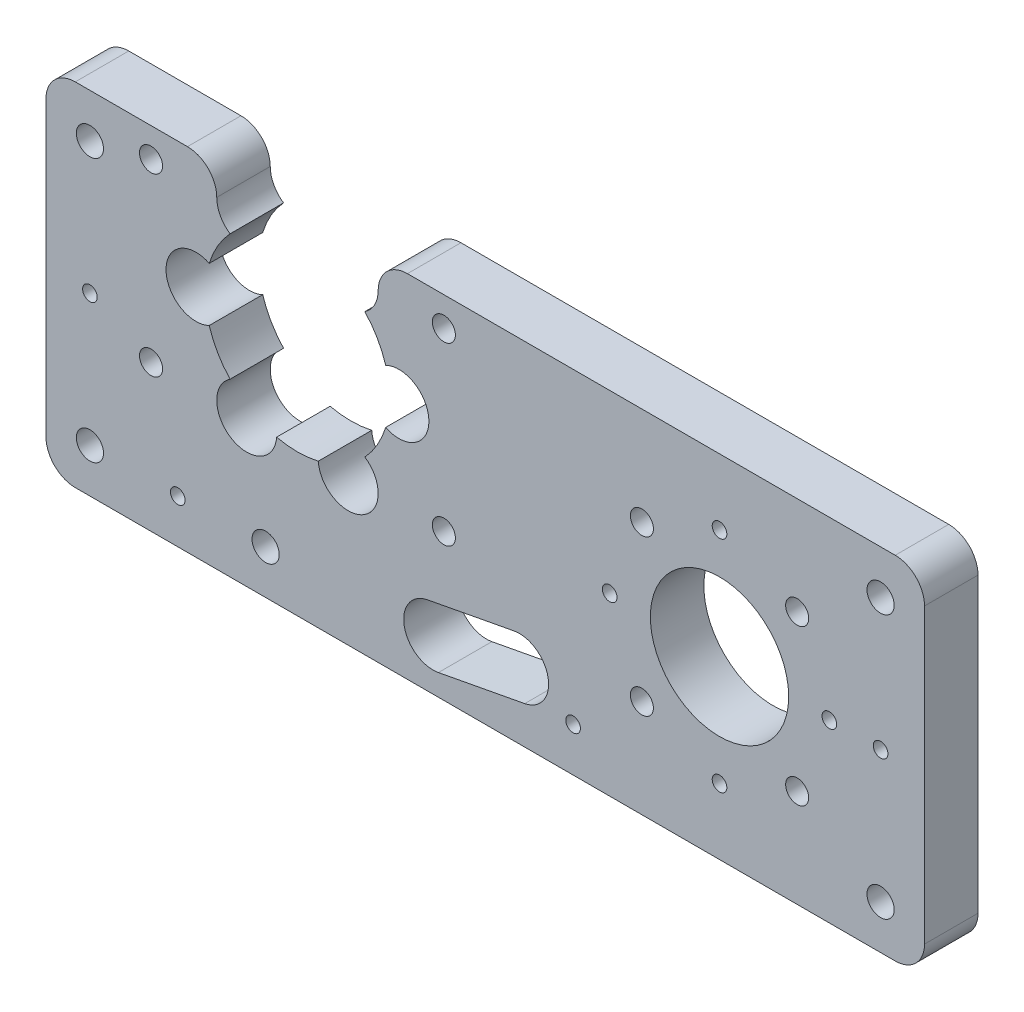
from build123d import *

# Parameters (mm, degrees)
SKETCH1_W                 = 95.25
SKETCH1_H                 = 38.1
SKETCH1_R                 = 7.5
SKETCH1_R_2               = 10
BOSS_EXTRUDE1_DEPTH       = 5.8
CBORE_FOR_M3_SHCS1_DEPTH  = 5.8
CUT_EXTRUDE1_DEPTH        = 103.751216538
FILLET1_R                 = 3.175
F_4_CLEARANCE_HOLE1_D     = 2.9464
F_4_CLEARANCE_HOLE1_DEPTH = 5.8
F_4_CLEARANCE_HOLE1_TIP   = 0.885187864
SKETCH11_R                = 0.79375
CUT_EXTRUDE2_DEPTH        = 103.751216538
FILLET2_R                 = 3.175
M3X0_5_TAPPED_HOLE1_D     = 2.5
M3X0_5_TAPPED_HOLE1_DEPTH = 7.5
M3X0_5_TAPPED_HOLE1_TIP   = 0.751075774
M3X0_5_TAPPED_HOLE2_D     = 2.5
M3X0_5_TAPPED_HOLE2_DEPTH = 8.5
M3X0_5_TAPPED_HOLE2_TIP   = 0.751075774
SKETCH17_R                = 0.79375
CUT_EXTRUDE3_DEPTH        = 103.751216538


# Read off the part's stored shape, not the designer's step: CBORE for M3 SHCS1
with BuildPart() as part:
    # Sketch1 → Boss-Extrude1 (new body)
    with BuildSketch(Plane.XY):
        with Locations((47.625, 19.05)):
            Rectangle(SKETCH1_W, SKETCH1_H)
        with Locations((73.025, 19.05)):
            Circle(SKETCH1_R, mode=Mode.SUBTRACT)
        with Locations((27.263471398, 25.4)):
            Circle(SKETCH1_R_2, mode=Mode.SUBTRACT)
    extrude(amount=BOSS_EXTRUDE1_DEPTH)

    # CBORE for M3 SHCS1 outline → CBORE for M3 SHCS1 (cut)
    with BuildSketch(Plane.XY):
        with BuildLine():
            ThreePointArc((34.571649716, 18.574274422), (32.263471398, 16.739745962), (29.520633989, 15.658069132))
            ThreePointArc((29.520633989, 15.658069132), (34.388471398, 13.059137996), (34.571649716, 18.574274422))
        make_face()
        with BuildLine():
            ThreePointArc((19.95529308, 18.574274422), (20.138471398, 13.059137996), (25.006308807, 15.658069132))
            ThreePointArc((25.006308807, 15.658069132), (22.263471398, 16.739745962), (19.95529308, 18.574274422))
        make_face()
        with BuildLine():
            ThreePointArc((36.828812307, 28.31620529), (37.263471398, 25.4), (36.828812307, 22.48379471))
            ThreePointArc((36.828812307, 22.48379471), (41.513471398, 25.4), (36.828812307, 28.31620529))
        make_face()
        with BuildLine():
            ThreePointArc((17.698130489, 28.31620529), (13.013471398, 25.4), (17.698130489, 22.48379471))
            ThreePointArc((17.698130489, 22.48379471), (17.263471398, 25.4), (17.698130489, 28.31620529))
        make_face()
        with BuildLine():
            ThreePointArc((19.95529308, 32.225725578), (27.263471398, 35.4), (34.571649716, 32.225725578))
            ThreePointArc((34.571649716, 32.225725578), (35.957138985, 35.528763749), (33.463469839, 38.1))
            Line((33.463469839, 38.1), (21.063472957, 38.1))
            ThreePointArc((21.063472957, 38.1), (18.56980381, 35.528763749), (19.95529308, 32.225725578))
        make_face()
    extrude(amount=CBORE_FOR_M3_SHCS1_DEPTH, mode=Mode.SUBTRACT)

    # Sketch3 → Cut-Extrude1 (cut, through all)
    with BuildSketch(Plane.XY.offset(5.8)):
        with BuildLine():
            Line((50.731096487, 10.325758959), (41.37076894, 8.562270029))
            ThreePointArc((41.37076894, 8.562270029), (38.838489401, 4.854331203), (42.546428227, 2.322051664))
            Line((42.546428227, 2.322051664), (51.906755774, 4.085540594))
            ThreePointArc((51.906755774, 4.085540594), (54.439035313, 7.79347942), (50.731096487, 10.325758959))
        make_face()
    extrude(amount=-CUT_EXTRUDE1_DEPTH, mode=Mode.SUBTRACT)

    # Fillet1
    fillet1_edges = [part.edges().sort_by_distance(p)[0] for p in [
        (0, 0, 2.9),
        (0, 38.1, 2.9),
        (95.25, 38.1, 2.9),
        (95.25, 0, 2.9),
    ]]
    fillet(fillet1_edges, radius=FILLET1_R)

    # #4 Clearance Hole1
    with Locations(Plane.XY.offset(5.8)):
        with Locations((4.7625, 33.3375), (4.7625, 4.7625), (23.8125, 4.7625), (90.4875, 4.7625), (90.4875, 33.3375)):
            Hole(F_4_CLEARANCE_HOLE1_D / 2, depth=F_4_CLEARANCE_HOLE1_DEPTH)
            with Locations((0, 0, -(F_4_CLEARANCE_HOLE1_DEPTH + F_4_CLEARANCE_HOLE1_TIP / 2))):  # 118° drill point
                Cone(0, F_4_CLEARANCE_HOLE1_D / 2, F_4_CLEARANCE_HOLE1_TIP, mode=Mode.SUBTRACT)

    # Sketch11 → Cut-Extrude2 (cut, through all)
    with BuildSketch(Plane.XY.offset(5.8)):
        with Locations((4.7625, 19.05)):
            Circle(SKETCH11_R)
        with Locations((14.2875, 4.7625)):
            Circle(SKETCH11_R)
        with Locations((57.15, 4.7625)):
            Circle(SKETCH11_R)
        with Locations((90.4875, 19.05)):
            Circle(SKETCH11_R)
    extrude(amount=-CUT_EXTRUDE2_DEPTH, mode=Mode.SUBTRACT)

    # Fillet2
    fillet2_edges = [part.edges().sort_by_distance(p)[0] for p in [
        (33.463469839, 38.1, 2.9),
        (21.063472957, 38.1, 2.9),
    ]]
    fillet(fillet2_edges, radius=FILLET2_R)

    # M3x0.5 Tapped Hole1
    with Locations(Plane.XY.offset(5.8)):
        with Locations((11.388471398, 34.925), (43.138471398, 34.925), (43.138471398, 15.875), (11.388471398, 15.875)):
            Hole(M3X0_5_TAPPED_HOLE1_D / 2, depth=M3X0_5_TAPPED_HOLE1_DEPTH)
            with Locations((0, 0, -(M3X0_5_TAPPED_HOLE1_DEPTH + M3X0_5_TAPPED_HOLE1_TIP / 2))):  # 118° drill point
                Cone(0, M3X0_5_TAPPED_HOLE1_D / 2, M3X0_5_TAPPED_HOLE1_TIP, mode=Mode.SUBTRACT)

    # M3x0.5 Tapped Hole2
    with Locations(Plane.XY.offset(5.8)):
        with Locations((64.606009886, 27.468990114), (81.443990114, 27.468990114), (81.443990114, 10.631009886), (64.606009886, 10.631009886)):
            Hole(M3X0_5_TAPPED_HOLE2_D / 2, depth=M3X0_5_TAPPED_HOLE2_DEPTH)
            with Locations((0, 0, -(M3X0_5_TAPPED_HOLE2_DEPTH + M3X0_5_TAPPED_HOLE2_TIP / 2))):  # 118° drill point
                Cone(0, M3X0_5_TAPPED_HOLE2_D / 2, M3X0_5_TAPPED_HOLE2_TIP, mode=Mode.SUBTRACT)

    # Sketch17 → Cut-Extrude3 (cut, through all)
    with BuildSketch(Plane.XY.offset(5.8)):
        with Locations((61.11875, 19.05)):
            Circle(SKETCH17_R)
        with Locations((73.025, 7.14375)):
            Circle(SKETCH17_R)
        with Locations((84.93125, 19.05)):
            Circle(SKETCH17_R)
        with Locations((73.025, 30.95625)):
            Circle(SKETCH17_R)
    extrude(amount=-CUT_EXTRUDE3_DEPTH, mode=Mode.SUBTRACT)


solid = part.part
